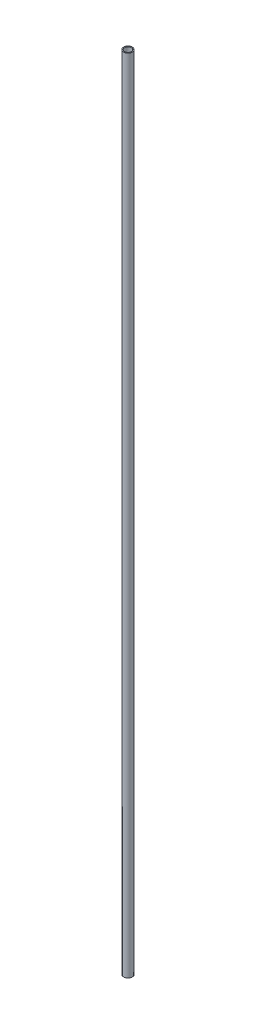
from build123d import *

# Parameters (mm, degrees)
SKETCH1_R           = 16.7005
SKETCH1_R_2         = 13.0683
BOSS_EXTRUDE1_DEPTH = 3048


with BuildPart() as part:
    # Sketch1 → Boss-Extrude1 (new body)
    with BuildSketch(Plane(origin=(0, 0, 0), x_dir=(1, 0, 0), z_dir=(0, 1, 0))):
        Circle(SKETCH1_R)
        Circle(SKETCH1_R_2, mode=Mode.SUBTRACT)
    extrude(amount=BOSS_EXTRUDE1_DEPTH)


solid = part.part
